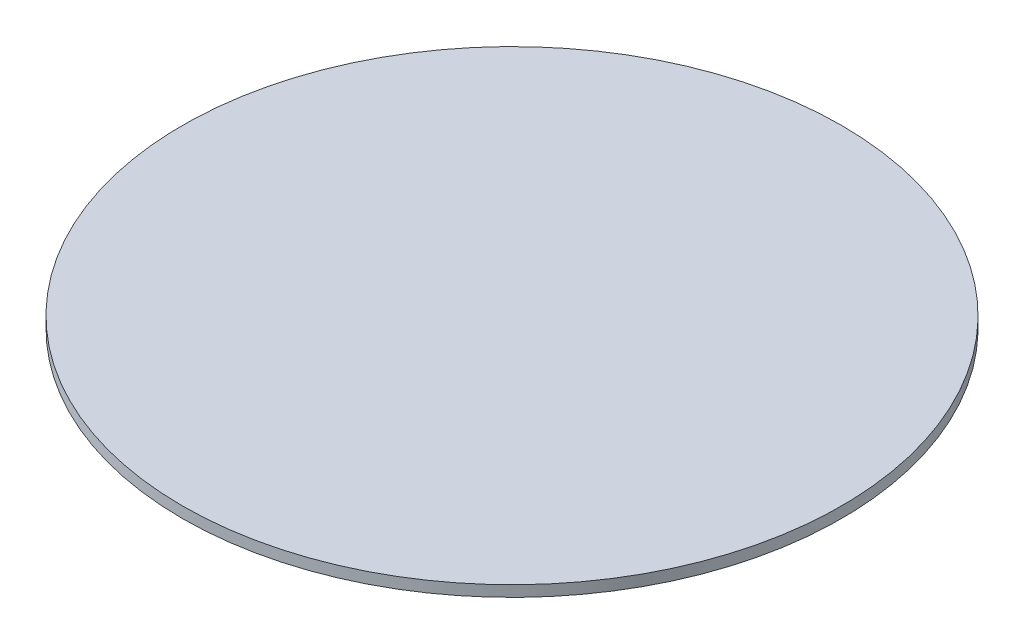
from build123d import *

# Parameters (mm, degrees)
SKETCH2_R           = 152.4
BOSS_EXTRUDE1_DEPTH = 5.08


with BuildPart() as part:
    # Sketch2 → Boss-Extrude1 (new body)
    with BuildSketch(Plane(origin=(0, 0, 0), x_dir=(1, 0, 0), z_dir=(0, 1, 0))):
        Circle(SKETCH2_R)
    extrude(amount=BOSS_EXTRUDE1_DEPTH)


solid = part.part
